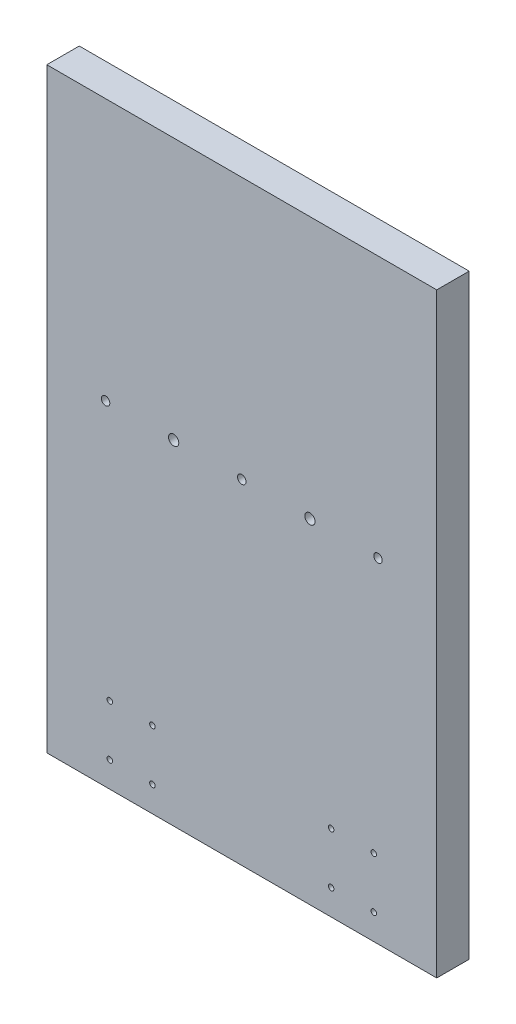
from build123d import *

# Parameters (mm, degrees)
SKETCH4_W           = 229
SKETCH4_H           = 350
BOSS_EXTRUDE1_DEPTH = 19.05
SKETCH3_W           = 195
SKETCH3_H           = 12.7
CUT_EXTRUDE1_DEPTH  = 9.525
SKETCH1_R           = 1.621
SKETCH1_R_2         = 2.5
SKETCH1_R_3         = 3
CUT_EXTRUDE2_DEPTH  = 277.270867409


with BuildPart() as part:
    # Sketch4 → Boss-Extrude1 (new body)
    with BuildSketch(Plane.XY):
        with Locations((-2.009760287, 74.776230729)):
            Rectangle(SKETCH4_W, SKETCH4_H)
    extrude(amount=BOSS_EXTRUDE1_DEPTH)

    # Sketch3 → Cut-Extrude1 (cut)
    with BuildSketch(Plane.XY):
        with Locations((-2.009760287, 96.126238169)):
            Rectangle(SKETCH3_W, SKETCH3_H)
    extrude(amount=CUT_EXTRUDE1_DEPTH, mode=Mode.SUBTRACT)

    # Sketch1 → Cut-Extrude2 (cut, through all)
    with BuildSketch(Plane.XY):
        with Locations((-79.509760287, -55.223769271)):
            Circle(SKETCH1_R)
        with Locations((-54.509760287, -55.223769271)):
            Circle(SKETCH1_R)
        with Locations((-82.009760287, 96.126238169)):
            Circle(SKETCH1_R_2)
        with Locations((-42.009760287, 96.126238169)):
            Circle(SKETCH1_R_3)
        with Locations((-2.009760287, 96.126238169)):
            Circle(SKETCH1_R_2)
        with Locations((37.990239713, 96.126238169)):
            Circle(SKETCH1_R_3)
        with Locations((77.990239713, 96.126238169)):
            Circle(SKETCH1_R_2)
        with Locations((-79.509760287, -85.223769271)):
            Circle(SKETCH1_R)
        with Locations((-54.509760287, -85.223769271)):
            Circle(SKETCH1_R)
        with Locations((50.490239713, -55.223769271)):
            Circle(SKETCH1_R)
        with Locations((75.490239713, -85.223769271)):
            Circle(SKETCH1_R)
        with Locations((50.490239713, -85.223769271)):
            Circle(SKETCH1_R)
        with Locations((75.490239713, -55.223769271)):
            Circle(SKETCH1_R)
    extrude(amount=CUT_EXTRUDE2_DEPTH, mode=Mode.SUBTRACT)


solid = part.part
